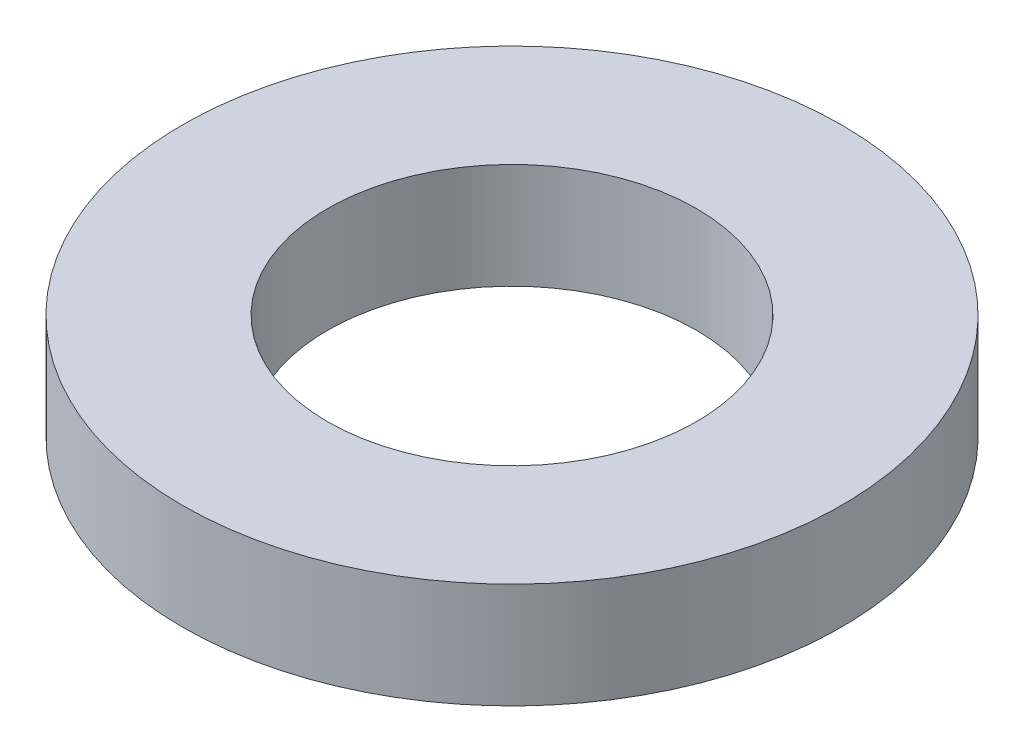
from build123d import *

# Parameters (mm, degrees)
SKETCH1_R           = 62.5
BOSS_EXTRUDE1_DEPTH = 20
SKETCH2_R           = 35
CUT_EXTRUDE1_DEPTH  = 91.622844802


with BuildPart() as part:
    # Sketch1 → Boss-Extrude1 (new body)
    with BuildSketch(Plane(origin=(0, 0, 0), x_dir=(1, 0, 0), z_dir=(0, 1, 0))):
        Circle(SKETCH1_R)
    extrude(amount=BOSS_EXTRUDE1_DEPTH)

    # Sketch2 → Cut-Extrude1 (cut, through all)
    with BuildSketch(Plane(origin=(0, 0, 0), x_dir=(1, 0, 0), z_dir=(0, 1, 0))):
        Circle(SKETCH2_R)
    extrude(amount=CUT_EXTRUDE1_DEPTH, mode=Mode.SUBTRACT)


solid = part.part
